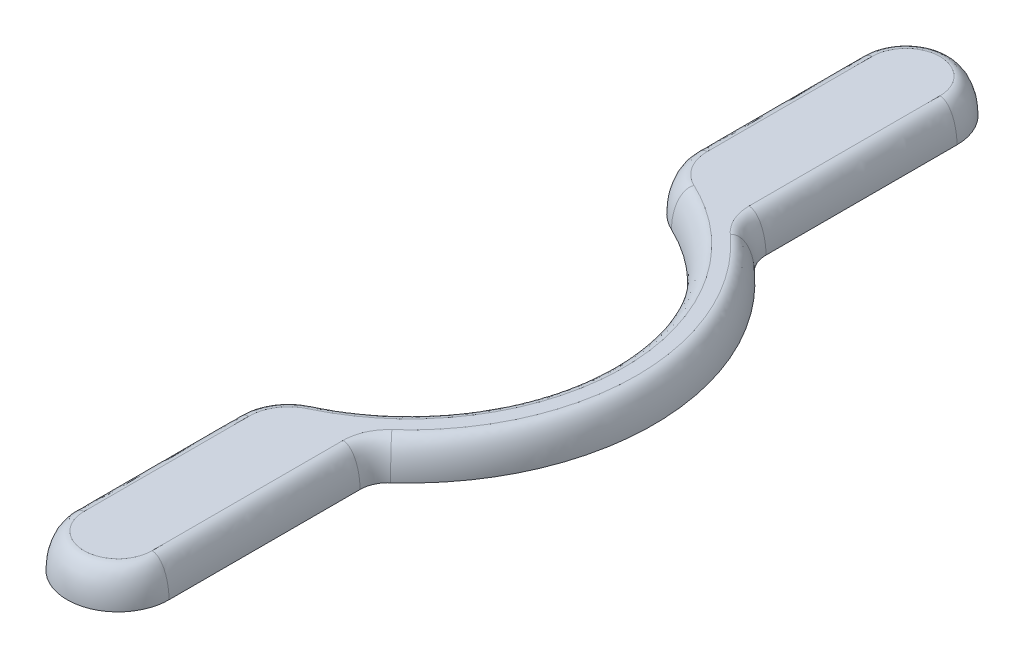
from build123d import *

# Parameters (mm, degrees)
SALIENTE_EXTRUIR1_DEPTH = 0.6
REDONDEO2_SIZE          = 0.6
REDONDEO2_SIZE_2        = 0.3


with BuildPart() as part:
    # Croquis1 → Saliente-Extruir1 (new body)
    with BuildSketch(Plane(origin=(0, 0.456148123, 0), x_dir=(1, 0, 0), z_dir=(0, 1, 0))):
        with BuildLine():
            Line((42.106397954, -64.746253755), (42.106397954, -61.377105609))
            ThreePointArc((42.106397954, -61.377105609), (42.149895732, -61.173130805), (42.272820837, -61.004645803))
            ThreePointArc((42.272820837, -61.004645803), (43.706397954, -57.796253755), (42.272820837, -54.587861707))
            ThreePointArc((42.272820837, -54.587861707), (42.149895732, -54.419376705), (42.106397954, -54.215401901))
            Line((42.106397954, -54.215401901), (42.106397954, -50.846253755))
            ThreePointArc((42.106397954, -50.846253755), (41.206397954, -49.946253755), (40.306397954, -50.846253755))
            Line((40.306397954, -50.846253755), (40.306397954, -53.752780221))
            ThreePointArc((40.306397954, -53.752780221), (40.461836022, -54.288238102), (40.87982824, -54.657234907))
            ThreePointArc((40.87982824, -54.657234907), (42.869987065, -57.796253755), (40.87982824, -60.935272603))
            ThreePointArc((40.87982824, -60.935272603), (40.461836022, -61.304269408), (40.306397954, -61.839727289))
            Line((40.306397954, -61.839727289), (40.306397954, -64.746253755))
            ThreePointArc((40.306397954, -64.746253755), (41.206397954, -65.646253755), (42.106397954, -64.746253755))
        make_face()
    extrude(amount=SALIENTE_EXTRUIR1_DEPTH)

    # Redondeo2
    # an asymmetric fillet: 0.6, 0.3 mm, written as the material it takes off along each edge
    with BuildSketch(Plane(origin=(40.306397954, 1.056148123, 50.846253755), x_dir=(0, -1, 0), z_dir=(0, 0, 1)), Plane(origin=(40.306397954, 1.056148123, 61.839727289), x_dir=(0, -1, 0), z_dir=(0, 0, 1))) as redondeo2_piece_1:
        with BuildLine():
            Bezier((REDONDEO2_SIZE, 0), (0, 0), (0, REDONDEO2_SIZE_2), weights=[1, 0.707106781, 1])
            Line((0, REDONDEO2_SIZE_2), (0, 0))
            Line((0, 0), (REDONDEO2_SIZE, 0))
        make_face()
    extrude(amount=2.906526466, mode=Mode.SUBTRACT)
    with BuildSketch(Plane(origin=(41.206397954, 1.056148123, 50.846253755), x_dir=(1, 0, 0), z_dir=(0, 0, 1))) as redondeo2_piece_2:
        with BuildLine():
            Bezier((0.9, -REDONDEO2_SIZE), (0.9, 0), (0.9 - REDONDEO2_SIZE_2, 0), weights=[1, 0.707106781, 1])
            Line((0.9 - REDONDEO2_SIZE_2, 0), (0.9, 0))
            Line((0.9, 0), (0.9, -REDONDEO2_SIZE))
        make_face()
    revolve(axis=Axis((41.206397954, 1.056148123, 50.846253755), (0, 1, 0)), revolution_arc=180, mode=Mode.SUBTRACT)
    with BuildSketch(Plane(origin=(39.399366704, 1.056148123, 57.796253755), x_dir=(0.4265697142932218, 0, -0.9044546859007361), z_dir=(-0.9044546859007361, 0, -0.4265697142932218))) as redondeo2_piece_3:
        with BuildLine():
            Bezier((3.470620361, REDONDEO2_SIZE), (3.470620361, 0), (3.470620361 + REDONDEO2_SIZE_2, 0), weights=[1, 0.707106781, 1])
            Line((3.470620361 + REDONDEO2_SIZE_2, 0), (3.470620361, 0))
            Line((3.470620361, 0), (3.470620361, REDONDEO2_SIZE))
        make_face()
    revolve(axis=Axis((39.399366704, 1.056148123, 57.796253755), (0, -1, 0)), revolution_arc=129.499876548, mode=Mode.SUBTRACT)
    with BuildSketch(Plane(origin=(42.106397954, 1.056148123, 54.215401901), x_dir=(0, -1, 0), z_dir=(0, 0, -1)), Plane(origin=(42.106397954, 1.056148123, 64.746253755), x_dir=(0, -1, 0), z_dir=(0, 0, -1))) as redondeo2_piece_4:
        with BuildLine():
            Bezier((REDONDEO2_SIZE, 0), (0, 0), (0, REDONDEO2_SIZE_2), weights=[1, 0.707106781, 1])
            Line((0, REDONDEO2_SIZE_2), (0, 0))
            Line((0, 0), (REDONDEO2_SIZE, 0))
        make_face()
    extrude(amount=3.369148146, mode=Mode.SUBTRACT)
    with BuildSketch(Plane(origin=(42.606397954, 1.056148123, 54.215401901), x_dir=(-0.6671542337071572, 0, 0.7449196120700649), z_dir=(0.7449196120700649, 0, 0.6671542337071572))) as redondeo2_piece_5:
        with BuildLine():
            Bezier((0.5, REDONDEO2_SIZE), (0.5, 0), (0.5 + REDONDEO2_SIZE_2, 0), weights=[1, 0.707106781, 1])
            Line((0.5 + REDONDEO2_SIZE_2, 0), (0.5, 0))
            Line((0.5, 0), (0.5, REDONDEO2_SIZE))
        make_face()
    revolve(axis=Axis((42.606397954, 1.056148123, 54.215401901), (0, -1, 0)), revolution_arc=48.15219468, mode=Mode.SUBTRACT)
    with BuildSketch(Plane(origin=(39.399366704, 1.056148123, 57.796253755), x_dir=(0.6671542337071441, 0, 0.7449196120700766), z_dir=(-0.7449196120700766, 0, 0.6671542337071441))) as redondeo2_piece_6:
        with BuildLine():
            Bezier((4.30703125, -REDONDEO2_SIZE), (4.30703125, 0), (4.30703125 - REDONDEO2_SIZE_2, 0), weights=[1, 0.707106781, 1])
            Line((4.30703125 - REDONDEO2_SIZE_2, 0), (4.30703125, 0))
            Line((4.30703125, 0), (4.30703125, -REDONDEO2_SIZE))
        make_face()
    revolve(axis=Axis((39.399366704, 1.056148123, 57.796253755), (0, 1, 0)), revolution_arc=96.304389359, mode=Mode.SUBTRACT)
    with BuildSketch(Plane(origin=(41.206397954, 1.056148123, 64.746253755), x_dir=(-1, 0, 0), z_dir=(0, 0, -1))) as redondeo2_piece_7:
        with BuildLine():
            Bezier((0.9, -REDONDEO2_SIZE), (0.9, 0), (0.9 - REDONDEO2_SIZE_2, 0), weights=[1, 0.707106781, 1])
            Line((0.9 - REDONDEO2_SIZE_2, 0), (0.9, 0))
            Line((0.9, 0), (0.9, -REDONDEO2_SIZE))
        make_face()
    revolve(axis=Axis((41.206397954, 1.056148123, 64.746253755), (0, 1, 0)), revolution_arc=180, mode=Mode.SUBTRACT)
    with BuildSketch(Plane(origin=(42.606397954, 1.056148123, 61.377105609), x_dir=(-1, 0, 0), z_dir=(0, 0, 1))) as redondeo2_piece_8:
        with BuildLine():
            Bezier((0.5, REDONDEO2_SIZE), (0.5, 0), (0.5 + REDONDEO2_SIZE_2, 0), weights=[1, 0.707106781, 1])
            Line((0.5 + REDONDEO2_SIZE_2, 0), (0.5, 0))
            Line((0.5, 0), (0.5, REDONDEO2_SIZE))
        make_face()
    revolve(axis=Axis((42.606397954, 1.056148123, 61.377105609), (0, -1, 0)), revolution_arc=48.15219468, mode=Mode.SUBTRACT)
    with BuildSketch(Plane(origin=(41.306397954, 1.056148123, 53.752780221), x_dir=(-1, 0, 0), z_dir=(0, 0, -1))) as redondeo2_piece_9:
        with BuildLine():
            Bezier((1, -REDONDEO2_SIZE), (1, 0), (1 - REDONDEO2_SIZE_2, 0), weights=[1, 0.707106781, 1])
            Line((1 - REDONDEO2_SIZE_2, 0), (1, 0))
            Line((1, 0), (1, -REDONDEO2_SIZE))
        make_face()
    revolve(axis=Axis((41.306397954, 1.056148123, 53.752780221), (0, 1, 0)), revolution_arc=64.749938274, mode=Mode.SUBTRACT)
    with BuildSketch(Plane(origin=(41.306397954, 1.056148123, 61.839727289), x_dir=(-0.4265697142932185, 0, -0.9044546859007376), z_dir=(0.9044546859007376, 0, -0.4265697142932185))) as redondeo2_piece_10:
        with BuildLine():
            Bezier((1, -REDONDEO2_SIZE), (1, 0), (1 - REDONDEO2_SIZE_2, 0), weights=[1, 0.707106781, 1])
            Line((1 - REDONDEO2_SIZE_2, 0), (1, 0))
            Line((1, 0), (1, -REDONDEO2_SIZE))
        make_face()
    revolve(axis=Axis((41.306397954, 1.056148123, 61.839727289), (0, 1, 0)), revolution_arc=64.749938274, mode=Mode.SUBTRACT)


solid = part.part
